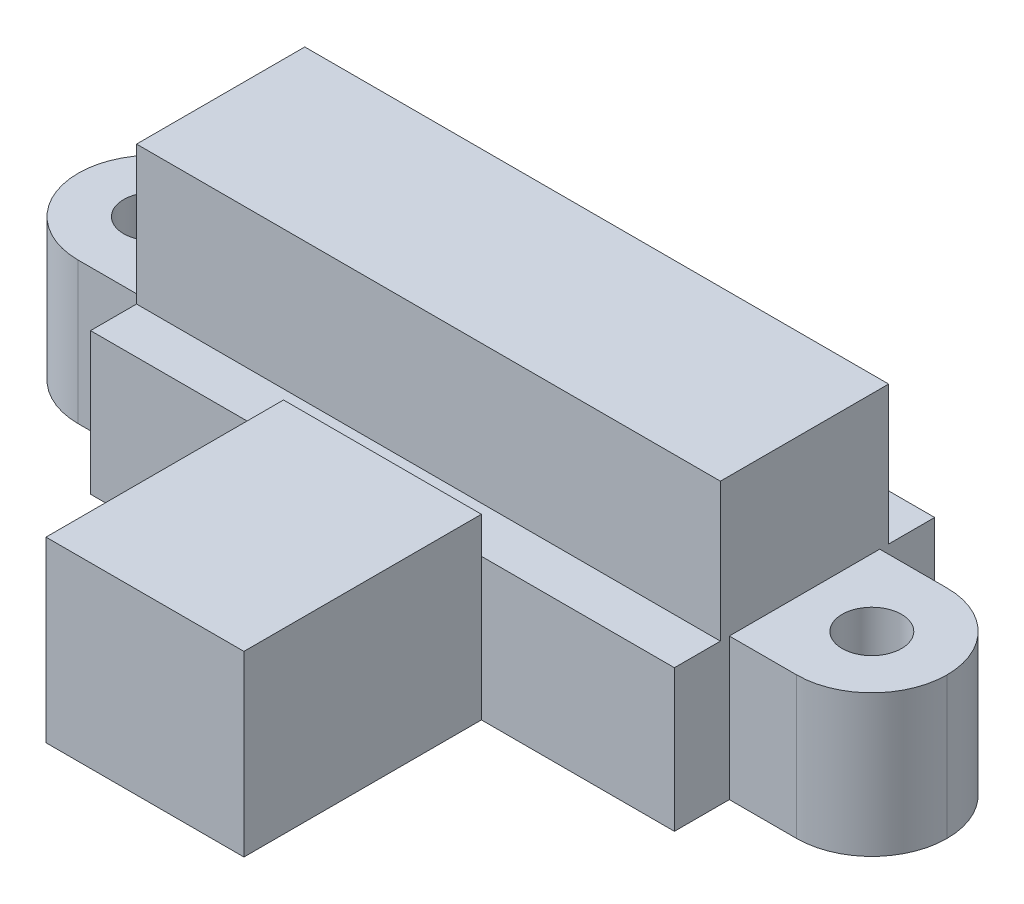
from build123d import *

# Parameters (mm, degrees)
BOSS_EXTRUDE1_DEPTH = 7.16
FILLET2_R           = 3.8
FILLET3_R           = 3.8
FILLET4_R           = 3.8
FILLET5_R           = 3.8
SKETCH2_W           = 29.5
SKETCH2_H           = 8.5
BOSS_EXTRUDE2_DEPTH = 7
SKETCH3_W           = 10
SKETCH3_H           = 9
BOSS_EXTRUDE4_DEPTH = 12
SKETCH4_R           = 1.5
CUT_EXTRUDE1_DEPTH  = 9


with BuildPart() as part:
    # Sketch1 → Boss-Extrude1 (new body)
    with BuildSketch(Plane(origin=(0, 0, 0), x_dir=(1, 0, 0), z_dir=(0, 1, 0))):
        Polygon((21.95, -3.8), (14.75, -3.8), (14.75, -6.575), (-14.75, -6.575), (-14.75, -3.8), (-21.95, -3.8), (-21.95, 3.8), (-14.75, 3.8), (-14.75, 6.575), (14.75, 6.575), (14.75, 3.8), (21.95, 3.8), align=None)
    extrude(amount=BOSS_EXTRUDE1_DEPTH)

    # Fillet2
    fillet2_edges = [part.edges().sort_by_distance(p)[0] for p in [
        (-21.95, 3.58, -3.8),
    ]]
    fillet(fillet2_edges, radius=FILLET2_R)

    # Fillet3
    fillet3_edges = [part.edges().sort_by_distance(p)[0] for p in [
        (-21.95, 3.58, 3.8),
    ]]
    fillet(fillet3_edges, radius=FILLET3_R - 0.0001)  # a hair under: the kernel refuses the full size

    # Fillet4
    fillet4_edges = [part.edges().sort_by_distance(p)[0] for p in [
        (21.95, 3.58, -3.8),
    ]]
    fillet(fillet4_edges, radius=FILLET4_R)

    # Fillet5
    fillet5_edges = [part.edges().sort_by_distance(p)[0] for p in [
        (21.95, 3.58, 3.8),
    ]]
    fillet(fillet5_edges, radius=FILLET5_R - 0.0001)  # a hair under: the kernel refuses the full size

    # Sketch2 → Boss-Extrude2 (add)
    with BuildSketch(Plane(origin=(0, 7.16, 0), x_dir=(1, 0, 0), z_dir=(0, 1, 0))):
        Rectangle(SKETCH2_W, SKETCH2_H)
    extrude(amount=BOSS_EXTRUDE2_DEPTH)

    # Sketch4 → Cut-Extrude1 (cut)
    with BuildSketch(Plane(origin=(0, 7.16, 0), x_dir=(1, 0, 0), z_dir=(0, 1, 0))):
        with Locations(Location((-18.15, 0, 0), (0, 0, 270))):
            Circle(SKETCH4_R)
        with Locations(Location((18.15, 0, 0), (0, 0, 270))):
            Circle(SKETCH4_R)
    extrude(amount=-CUT_EXTRUDE1_DEPTH, mode=Mode.SUBTRACT)


with BuildPart() as body_2:
    # Sketch3 → Boss-Extrude4 (new body)
    with BuildSketch(Plane.XY.offset(6.575)):
        with Locations((0, 4.5)):
            Rectangle(SKETCH3_W, SKETCH3_H)
    extrude(amount=BOSS_EXTRUDE4_DEPTH)


solid = Compound([part.part, body_2.part])
